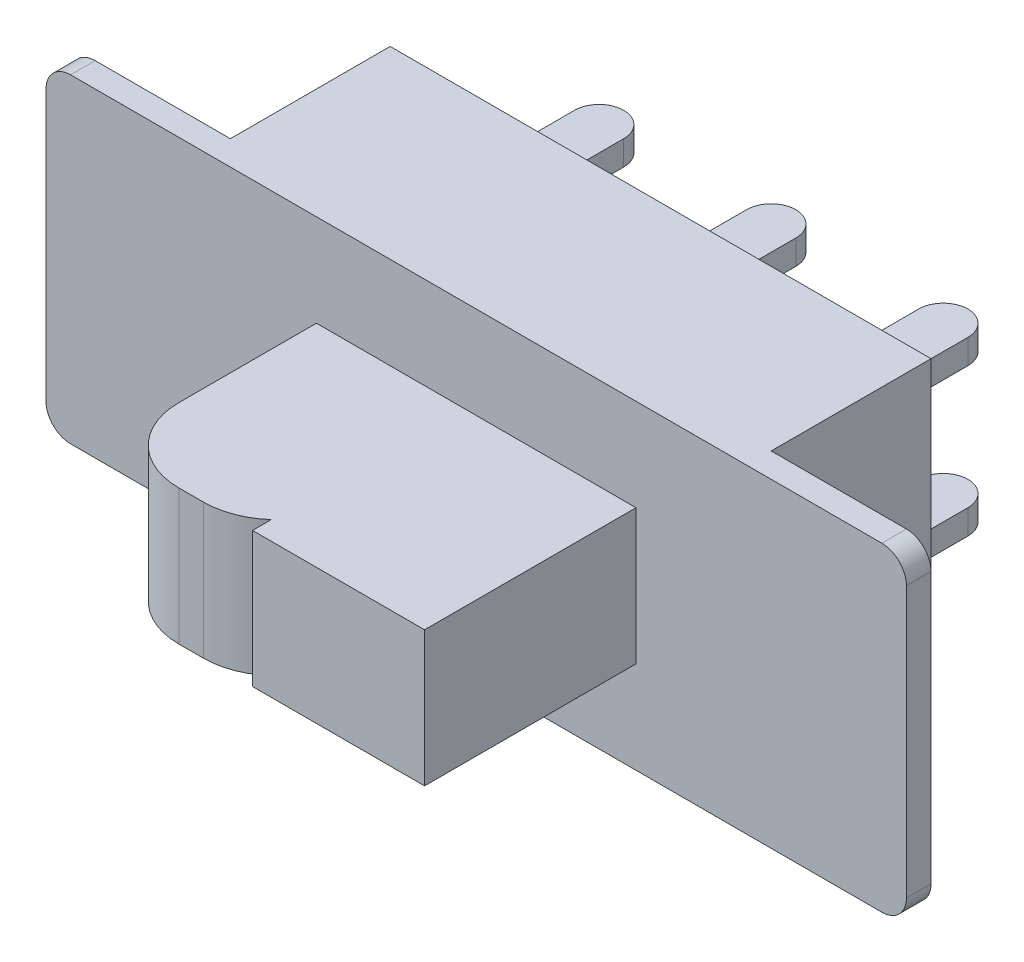
from build123d import *

# Parameters (mm, degrees)
SKETCH_1_W             = 22
SKETCH_1_H             = 13
EXTRUDE_1_DEPTH        = 7.5
SKETCH_2_W             = 6.5
SKETCH_2_H             = 13
EXTRUDE_2_DEPTH        = 1
FILLET_1_R             = 1
SKETCH_3_W             = 2
SKETCH_3_H             = 5.5
EXTRUDE_3_DEPTH        = 0.5
FILLET_2_R             = 1
FILLET_2_OF_MIRROR_1_R = 1
SKETCH_4_W             = 7
SKETCH_4_H             = 5.5
EXTRUDE_4_DEPTH        = 8.6
FILLET_3_R             = 3


with BuildPart() as part:
    # Эскиз1 → Бобышка-Вытянуть1 (new body)
    with BuildSketch(Plane.XY):
        with Locations((11, 6.5)):
            Rectangle(SKETCH_1_W, SKETCH_1_H)
    extrude(amount=EXTRUDE_1_DEPTH)

    # Эскиз2 → Бобышка-Вытянуть2 (add)
    with BuildSketch(Plane.XY.offset(7.5)):
        with Locations((-3.25, 6.5)):
            Rectangle(SKETCH_2_W, SKETCH_2_H)
        with Locations((25.25, 6.5)):
            Rectangle(SKETCH_2_W, SKETCH_2_H)
    extrude(amount=-EXTRUDE_2_DEPTH)

    # Скругление1
    fillet_1_edges = [part.edges().sort_by_distance(p)[0] for p in [
        (28.5, 13, 7),
        (28.5, 0, 7),
        (-6.5, 13, 7),
        (-6.5, 0, 7),
    ]]
    fillet(fillet_1_edges, radius=FILLET_1_R)

    # Эскиз3 → Бобышка-Вытянуть3 (add, symmetric)
    with BuildSketch(Plane(origin=(0, 3.5, 0), x_dir=(-1, 0, 0), z_dir=(0, -1, 0))):
        with Locations((-4, 2.75)):
            Rectangle(SKETCH_3_W, SKETCH_3_H)
        with Locations((-18, 2.75)):
            Rectangle(SKETCH_3_W, SKETCH_3_H)
        with Locations((-11, 2.75)):
            Rectangle(SKETCH_3_W, SKETCH_3_H)
    extrude_3 = extrude(amount=EXTRUDE_3_DEPTH, both=True)

    # Скругление2
    fillet_2_edges = [part.edges().sort_by_distance(p)[0] for p in [
        (19, 3.5, -5.5),
        (17, 3.5, -5.5),
        (12, 3.5, -5.5),
        (10, 3.5, -5.5),
        (5, 3.5, -5.5),
        (3, 3.5, -5.5),
    ]]
    fillet(fillet_2_edges, radius=FILLET_2_R - 0.0001)  # a hair under: the kernel refuses the full size

    # Зеркальное отражение1: Бобышка-Вытянуть3 across plane
    add(extrude_3.mirror(Plane(origin=(0, 6.5, 0), x_dir=(0, 0, 1), z_dir=(0, -1, 0))))

    # Скругление2 of Зеркальное отражение1
    fillet_2_of_mirror_1_edges = [part.edges().sort_by_distance(p)[0] for p in [
        (19, 9.5, -5.5),
        (17, 9.5, -5.5),
        (12, 9.5, -5.5),
        (10, 9.5, -5.5),
        (5, 9.5, -5.5),
        (3, 9.5, -5.5),
    ]]
    fillet(fillet_2_of_mirror_1_edges, radius=FILLET_2_OF_MIRROR_1_R - 0.0001)  # a hair under: the kernel refuses the full size

    # Эскиз4 → Бобышка-Вытянуть4 (add)
    with BuildSketch(Plane.XY.offset(7.5)):
        with Locations((8, 6.5)):
            Rectangle(SKETCH_4_W, SKETCH_4_H)
    extrude_4 = extrude(amount=EXTRUDE_4_DEPTH)

    # Скругление3
    fillet_3_edges = [part.edges().sort_by_distance(p)[0] for p in [
        (11.5, 6.5, 16.1),
        (4.5, 6.5, 16.1),
    ]]
    fillet(fillet_3_edges, radius=FILLET_3_R)

    # Зеркальное отражение4: Бобышка-Вытянуть4 across plane
    add(extrude_4.mirror(Plane(origin=(11, 0, 0), x_dir=(0, 0, 1), z_dir=(1, 0, 0))))


solid = part.part
